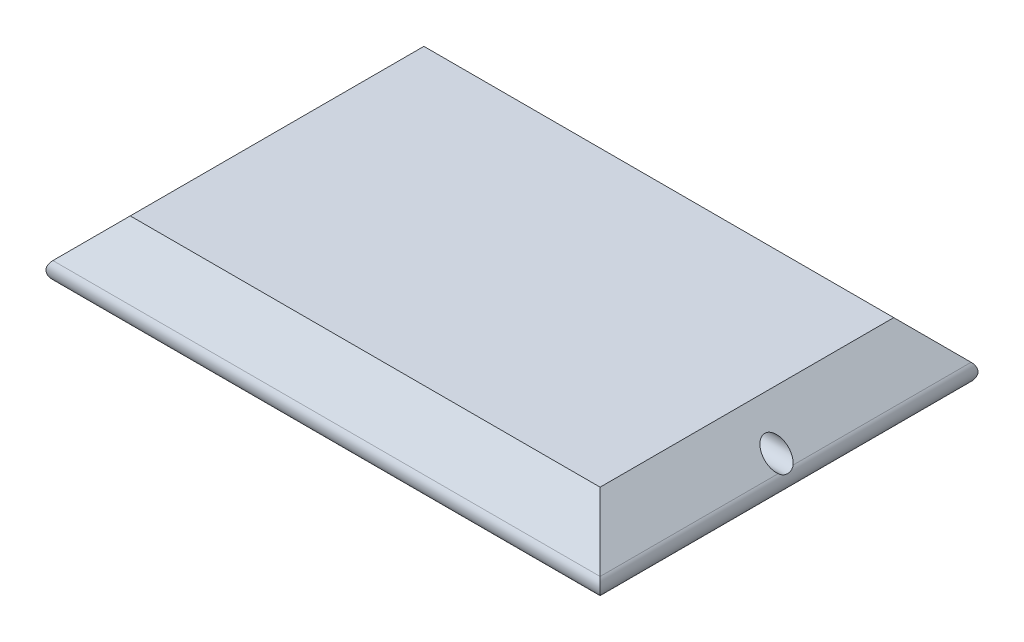
from build123d import *

# Parameters (mm, degrees)
SKETCH_1_W      = 100
SKETCH_1_H      = 70
EXTRUDE_1_DEPTH = 10
EXTRUDE_1_TAPER = 45
SKETCH_5_W      = 28.87382981
SKETCH_5_H      = 2
FILLET_1_R      = 2


with BuildPart() as part:
    # 草图1 → 凸台-拉伸1 (new body)
    with BuildSketch(Plane(origin=(0, 0, 0), x_dir=(1, 0, 0), z_dir=(0, 1, 0))):
        Rectangle(SKETCH_1_W, SKETCH_1_H)
    extrude(amount=EXTRUDE_1_DEPTH, taper=EXTRUDE_1_TAPER)

    # 草图2 one side → 切除-旋转2 (revolve, cut)
    with BuildSketch(Plane.XY):
        with BuildLine():
            ThreePointArc((21.414207954, 4.814992755), (25.414207954, 0.814992755), (29.414207954, 4.814992755))
            Line((29.414207954, 4.814992755), (21.414207954, 4.814992755))
        make_face()
    revolve(axis=Axis((65.414207954, 4.814992755, 0), (-1, 0, 0)), mode=Mode.SUBTRACT)

    # 草图5 → 切除-旋转4 (revolve, cut)
    with BuildSketch(Plane.XY, mode=Mode.PRIVATE) as cut_revolve_4_sk:
        with Locations((40.362985489, 5.961536801)):
            Rectangle(SKETCH_5_W, SKETCH_5_H)
    revolve(cut_revolve_4_sk.sketch.rotate(Axis((54.799900394, 4.961536801, 0), (-1, 0, 0)), 134.067661737), axis=Axis((54.799900394, 4.961536801, 0), (-1, 0, 0)), mode=Mode.SUBTRACT)

    # 圆角1
    # the kernel refuses this fillet: 2 mm, written as the material it takes off along each edge
    with BuildSketch(Plane(origin=(-62.071067812, 0, 35), x_dir=(0, 0.7071067811865464, -0.7071067811865487), z_dir=(1, 0, 0)), Plane(origin=(62.071067812, 0, -35), x_dir=(0, 0.7071067811865461, 0.707106781186549), z_dir=(-1, 0, 0))) as fillet_1_piece_1:
        with BuildLine():
            CenterArc((FILLET_1_R * 2.41421356237, -FILLET_1_R), FILLET_1_R, 90, 135)
            Line((FILLET_1_R * 1.70710678119, -FILLET_1_R * 1.70710678119), (0, 0))
            Line((0, 0), (FILLET_1_R * 2.41421356237, 0))
        make_face()
    extrude(amount=124.142135624, mode=Mode.SUBTRACT)
    with BuildSketch(Plane(origin=(-50, 0, -47.071067812), x_dir=(0.7071067811865483, 0.7071067811865466, 0), z_dir=(0, 0, 1)), Plane(origin=(50, 0, 47.071067812), x_dir=(-0.7071067811865485, 0.7071067811865467, 0), z_dir=(0, 0, -1))) as fillet_1_piece_2:
        with BuildLine():
            CenterArc((FILLET_1_R * 2.41421356237, -FILLET_1_R), FILLET_1_R, 90, 135)
            Line((FILLET_1_R * 1.70710678119, -FILLET_1_R * 1.70710678119), (0, 0))
            Line((0, 0), (FILLET_1_R * 2.41421356237, 0))
        make_face()
    extrude(amount=94.142135624, mode=Mode.SUBTRACT)


solid = part.part
